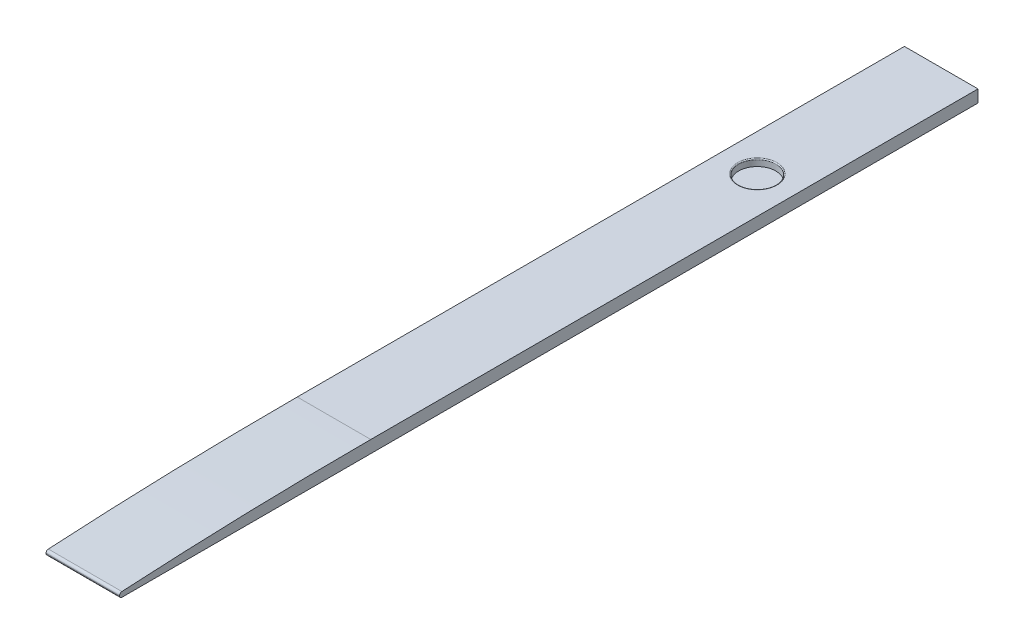
from build123d import *

# Parameters (mm, degrees)
EXTRUDE_1_DEPTH     = 30
FILLET_1_R          = 1750
SKETCH_4_R          = 7.6
CUT_EXTRUDE_3_DEPTH = 2.8
FILLET_4_R          = 0.4
SKETCH_5_W          = 20
SKETCH_5_H          = 2
CUT_EXTRUDE_4_DEPTH = 25
FILLET_5_R          = 1


with BuildPart() as part:
    # 草图1 → 凸台-拉伸1 (new body)
    with BuildSketch(Plane(origin=(0, 0, 0), x_dir=(0, 0, -1), z_dir=(1, 0, 0))):
        Polygon((0, 0), (-350, 0), (-350, 2), (-300, 5), (0, 5), align=None)
    extrude(amount=EXTRUDE_1_DEPTH)

    # 圆角1
    # the kernel refuses this fillet: 1750 mm, written as the material it takes off along each edge
    with BuildSketch(Plane(origin=(-131.063956855, 5, 300), x_dir=(0, -0.05989229072794672, 0.9982048454657786), z_dir=(1, 0, 0))) as fillet_1_piece_1:
        with BuildLine():
            CenterArc((52.480038055, 1749.998367808), FILLET_1_R, 266.566369638, 3.35537678)
            Line((-52.331470719, 3.139888243), (-54.427700895, -31.797281348))
            Line((-54.427700895, -31.797281348), (-2.096230175, -34.937169591))
            Line((-2.096230175, -34.937169591), (0, -35))
            ThreePointArc((0, -35), (25.044959573, -35), (50.042116767, -34.999967356))
            Line((50.042116767, -34.999967356), (50.089919145, 0))
        make_face()
    extrude(amount=292.127913709, mode=Mode.SUBTRACT)

    # 草图4 → 切除-拉伸3 (cut)
    with BuildSketch(Plane(origin=(0, 5, 0), x_dir=(1, 0, 0), z_dir=(0, 1, 0))):
        with Locations(Location((15, -75, 0), (0, 0, 270))):
            Circle(SKETCH_4_R)
    extrude(amount=-CUT_EXTRUDE_3_DEPTH, mode=Mode.SUBTRACT)

    # 圆角4
    fillet_4_edges = [part.edges().sort_by_distance(p)[0] for p in [
        (15, 5, 67.4),
    ]]
    fillet(fillet_4_edges, radius=FILLET_4_R)

    # 草图5 → 切除-拉伸4 (cut)
    with BuildSketch(Plane(origin=(0, 0, 0), x_dir=(-1, 0, 0), z_dir=(0, 0, -1))):
        with Locations((-15, 2.5)):
            Rectangle(SKETCH_5_W, SKETCH_5_H)
    extrude(amount=-CUT_EXTRUDE_4_DEPTH, mode=Mode.SUBTRACT)

    # 圆角5
    fillet_5_edges = [part.edges().sort_by_distance(p)[0] for p in [
        (15, 0, 350),
        (15, 2, 350),
    ]]
    fillet(fillet_5_edges, radius=FILLET_5_R)


solid = part.part
